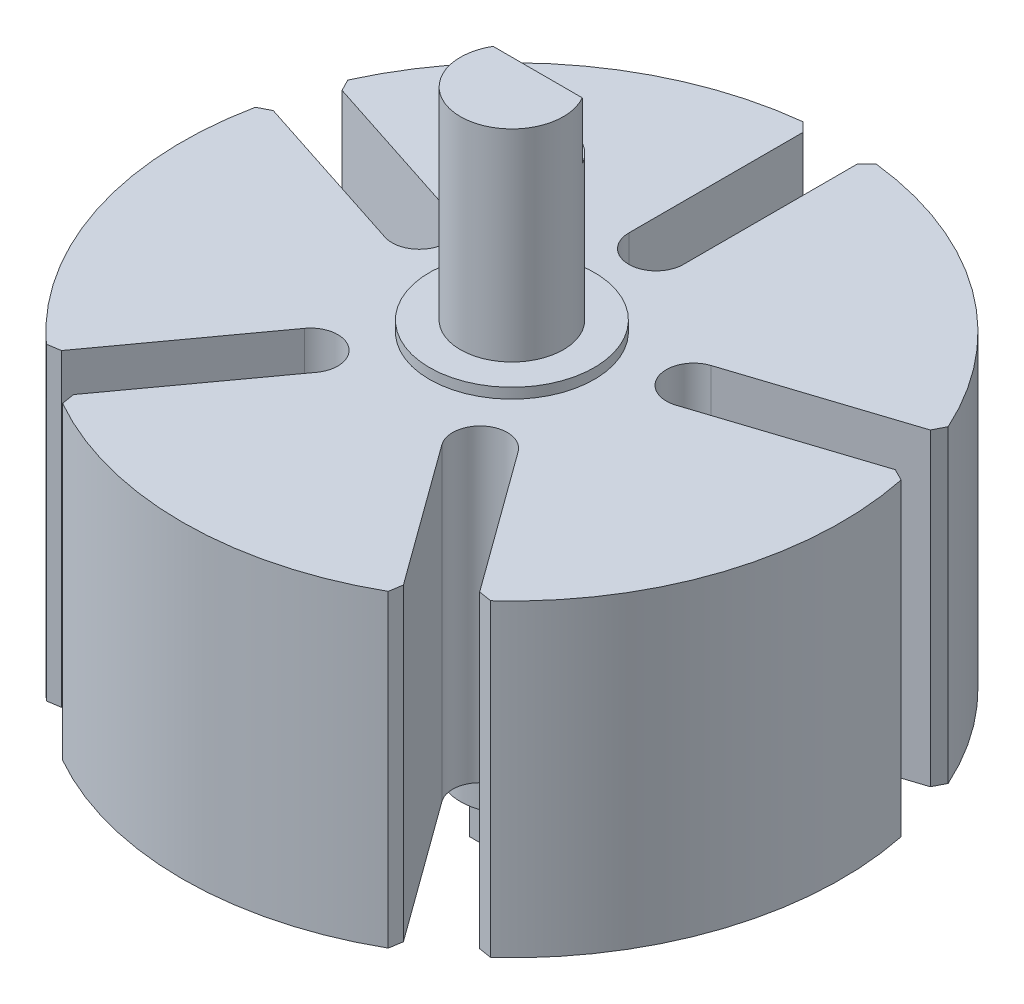
from build123d import *

# Parameters (mm, degrees)
SKETCH_1_R               = 16
EXTRUDE_1_DEPTH          = 15
SKETCH_2_R               = 4
EXTRUDE_2_DEPTH          = 0.5
EXTRUDE_START            = 0.5
SKETCH_3_R               = 4
EXTRUDE_3_DEPTH          = 0.5
SKETCH_4_R               = 2.5
EXTRUDE_4_DEPTH          = 9.8
EXTRUDE_START_2          = 3
SKETCH_5_R               = 2.5
EXTRUDE_5_DEPTH          = 3
CUT_EXTRUDE_START        = -2.8
CUT_EXTRUDE_1_DEPTH      = 2.8
CUT_EXTRUDE_2_DEPTH      = 30.227555491
PATTERN_CIRCULAR_1_COUNT = 5
SKETCH_8_R               = 1.5
EXTRUDE_6_DEPTH          = 3
CHAMFER_1_SIZE           = 0.5
CUT_EXTRUDE_START_2      = -3
CUT_EXTRUDE_3_DEPTH      = 3


with BuildPart() as part:
    # 草图1 → 凸台-拉伸1 (new body)
    with BuildSketch(Plane(origin=(0, 0, 0), x_dir=(1, 0, 0), z_dir=(0, 1, 0))):
        with Locations(Location((0, 0, 0), (0, 0, 270))):
            Circle(SKETCH_1_R)
    extrude(amount=EXTRUDE_1_DEPTH)

    # 草图2 → 凸台-拉伸2 (add)
    with BuildSketch(Plane(origin=(0, 15, 0), x_dir=(1, 0, 0), z_dir=(0, 1, 0))):
        with Locations(Location((0, 0, 0), (0, 0, 270))):
            Circle(SKETCH_2_R)
    extrude(amount=EXTRUDE_2_DEPTH)

    # 草图3 → 凸台-拉伸3 (add)
    with BuildSketch(Plane.XZ.offset(EXTRUDE_START)):
        with Locations(Location((0, 0, 0), (0, 0, 90))):
            Circle(SKETCH_3_R)
    extrude(amount=-EXTRUDE_3_DEPTH)

    # 草图4 → 凸台-拉伸4 (add)
    with BuildSketch(Plane(origin=(0, 15.5, 0), x_dir=(1, 0, 0), z_dir=(0, 1, 0))):
        with Locations(Location((0, 0, 0), (0, 0, 270))):
            Circle(SKETCH_4_R)
    extrude(amount=EXTRUDE_4_DEPTH)

    # 草图5 → 凸台-拉伸5 (add)
    with BuildSketch(Plane.XZ.offset(0.5).offset(EXTRUDE_START_2)):
        with Locations(Location((0, 0, 0), (0, 0, 90))):
            Circle(SKETCH_5_R)
    extrude(amount=-EXTRUDE_5_DEPTH)

    # 草图6 → 切除-拉伸1 (cut)
    with BuildSketch(Plane(origin=(0, 25.3, 0), x_dir=(1, 0, 0), z_dir=(0, 1, 0)).offset(CUT_EXTRUDE_START)):
        with BuildLine():
            Line((-2.165063509, 1.25), (2.165063509, 1.25))
            ThreePointArc((2.165063509, 1.25), (0, 2.5), (-2.165063509, 1.25))
        make_face()
    extrude(amount=CUT_EXTRUDE_1_DEPTH, mode=Mode.SUBTRACT)

    # 草图7 → 切除-拉伸2 (cut, through all)
    with BuildSketch(Plane(origin=(0, 15, 0), x_dir=(1, 0, 0), z_dir=(0, 1, 0))):
        with BuildLine():
            Line((-1.325, 7), (-1.325, 19))
            Line((-1.325, 19), (1.325, 19))
            Line((1.325, 19), (1.325, 7))
            ThreePointArc((1.325, 7), (0, 5.675), (-1.325, 7))
        make_face()
    cut_extrude_2 = extrude(amount=-CUT_EXTRUDE_2_DEPTH, mode=Mode.SUBTRACT)

    # 阵列(圆周)1: 切除-拉伸2 ×5 about axis
    pattern_circular_1_axis = Axis((0, 0, 0), (0, 1, 0))
    for i in range(1, PATTERN_CIRCULAR_1_COUNT):
        add(cut_extrude_2.rotate(pattern_circular_1_axis, i * 360 / PATTERN_CIRCULAR_1_COUNT), mode=Mode.SUBTRACT)

    # 草图8 → 凸台-拉伸6 (add)
    with BuildSketch(Plane.XZ.offset(3.5)):
        with Locations(Location((0, 0, 0), (0, 0, 270))):
            Circle(SKETCH_8_R)
    extrude(amount=EXTRUDE_6_DEPTH)

    # 倒角1
    # the kernel refuses this chamfer: 0.5, 0.463229901 mm, written as the material it takes off along each edge
    with BuildSketch(Plane(origin=(-1.325, 16.285841494, -15.945042333), x_dir=(-0.9952786218717831, 0, 0.09705907914772452), z_dir=(0, -1, 0)), Plane(origin=(14.755188896, 16.285841494, -6.187438941), x_dir=(-0.39986667798550435, 0, -0.9165733139453914), z_dir=(0, -1, 0)), Plane(origin=(10.444208248, 16.285841494, 12.120994764), x_dir=(0.7481474239082289, 0, -0.6635325403471037), z_dir=(0, -1, 0)), Plane(origin=(-8.300313213, 16.285841494, 13.678625683), x_dir=(0.8622472145564707, 0, 0.5064876513693177), z_dir=(0, -1, 0)), Plane(origin=(-15.574083931, 16.285841494, -3.667139173), x_dir=(-0.21524933860740833, 0, 0.9765591237754493), z_dir=(0, -1, 0))) as chamfer_1_piece_1:
        with BuildLine():
            Line((0.457733904, 0), (CHAMFER_1_SIZE * 0.0970590791477, -CHAMFER_1_SIZE * 0.995278621872))
            Line((CHAMFER_1_SIZE * 0.0970590791477, -CHAMFER_1_SIZE * 0.995278621872), (0, 0))
            ThreePointArc((0, 0), (0.235215907, 0.001635702), (0.457733904, 0))
        make_face()
    extrude(amount=17.571682988, mode=Mode.SUBTRACT)
    with BuildSketch(Plane(origin=(1.325, 16.285841494, -15.945042333), x_dir=(0, 0, 1), z_dir=(0, -1, 0)), Plane(origin=(15.574083931, 16.285841494, -3.667139173), x_dir=(-0.9510565162951534, 0, 0.3090169943749483), z_dir=(0, -1, 0)), Plane(origin=(8.300313213, 16.285841494, 13.678625683), x_dir=(-0.5877852522924737, 0, -0.809016994374947), z_dir=(0, -1, 0)), Plane(origin=(-14.755188896, 16.285841494, -6.187438941), x_dir=(0.9510565162951536, 0, 0.3090169943749472), z_dir=(0, -1, 0))) as chamfer_1_piece_2:
        with BuildLine():
            Line((CHAMFER_1_SIZE, 0), (0.044427231, -0.455572769))
            ThreePointArc((0.044427231, -0.455572769), (0.02120186, -0.234264124), (0, 0))
            Line((0, 0), (CHAMFER_1_SIZE, 0))
        make_face()
    extrude(amount=17.571682988, mode=Mode.SUBTRACT)
    with BuildSketch(Plane(origin=(-10.444208248, 16.285841494, 12.120994764), x_dir=(-0.7481474239082269, 0, -0.6635325403471058), z_dir=(0, -1, 0))) as chamfer_1_piece_3:
        with BuildLine():
            Line((0.457733904, 0), (CHAMFER_1_SIZE * 0.0970590791477, CHAMFER_1_SIZE * 0.995278621872))
            Line((CHAMFER_1_SIZE * 0.0970590791477, CHAMFER_1_SIZE * 0.995278621872), (0, 0))
            ThreePointArc((0, 0), (0.235215907, -0.001635702), (0.457733904, 0))
        make_face()
    extrude(amount=17.571682988, mode=Mode.SUBTRACT)

    # 草图9 → 切除-拉伸3 (cut)
    with BuildSketch(Plane.XZ.offset(6.5).offset(CUT_EXTRUDE_START_2)):
        with BuildLine():
            Line((-1.299038106, 0.75), (1.299038106, 0.75))
            ThreePointArc((1.299038106, 0.75), (0, 1.5), (-1.299038106, 0.75))
        make_face()
    extrude(amount=CUT_EXTRUDE_3_DEPTH, mode=Mode.SUBTRACT)


solid = part.part
